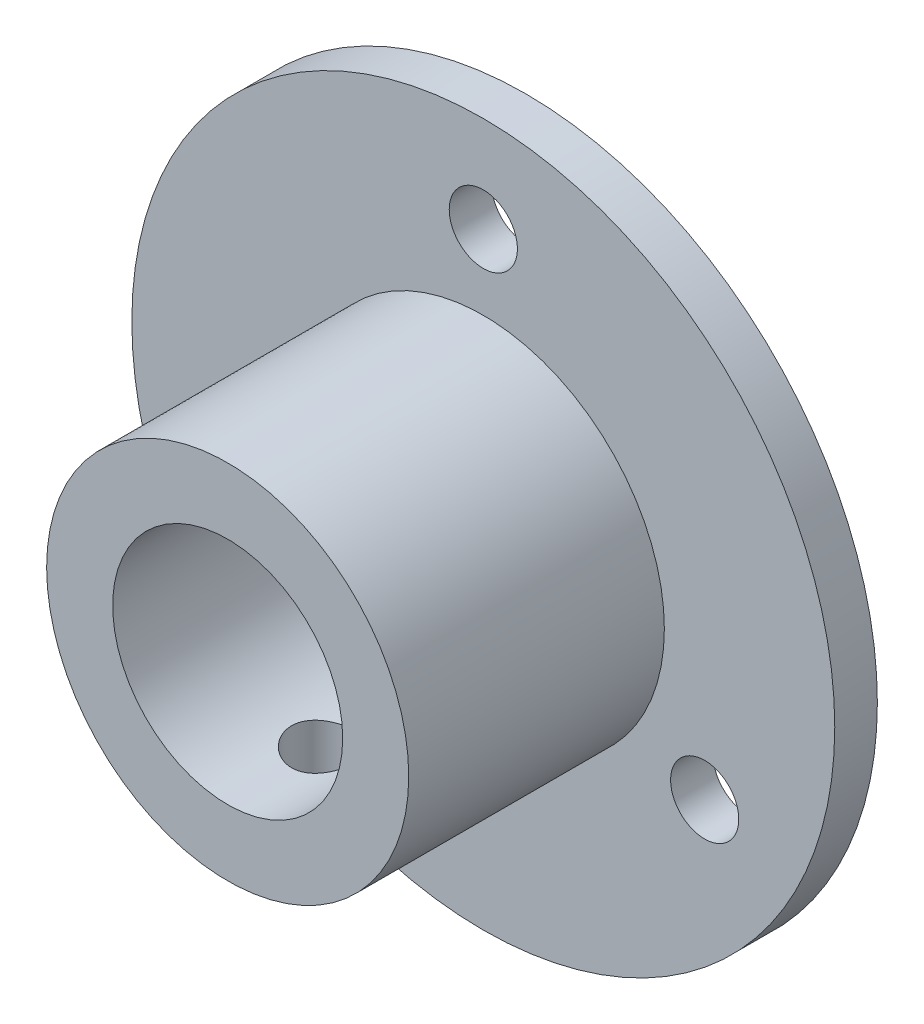
from build123d import *

# Parameters (mm, degrees)
SKETCH_1_R          = 16.5
EXTRUDE_1_DEPTH     = 2
SKETCH_2_R          = 8.5
EXTRUDE_2_DEPTH     = 12
SKETCH_3_R          = 5.4
CUT_EXTRUDE_1_DEPTH = 29
SKETCH_4_R          = 1.6
CUT_EXTRUDE_2_DEPTH = 29
CUT_EXTRUDE_3_DEPTH = 12


with BuildPart() as part:
    # 草图1 → 凸台-拉伸1 (new body)
    with BuildSketch(Plane.XY):
        Circle(SKETCH_1_R)
    extrude(amount=EXTRUDE_1_DEPTH)

    # 草图2 → 凸台-拉伸2 (add)
    with BuildSketch(Plane.XY.offset(2)):
        Circle(SKETCH_2_R)
    extrude(amount=EXTRUDE_2_DEPTH)

    # 草图3 → 切除-拉伸1 (cut)
    with BuildSketch(Plane.XY.offset(14)):
        Circle(SKETCH_3_R)
    extrude(amount=-CUT_EXTRUDE_1_DEPTH, mode=Mode.SUBTRACT)

    # 草图4 → 切除-拉伸2 (cut)
    with BuildSketch(Plane(origin=(0, 0, 0), x_dir=(-1, 0, 0), z_dir=(0, 0, -1))):
        with Locations((0, 12)):
            Circle(SKETCH_4_R)
        with Locations((10.392304845, -6)):
            Circle(SKETCH_4_R)
        with Locations((-10.392304845, -6)):
            Circle(SKETCH_4_R)
    extrude(amount=-CUT_EXTRUDE_2_DEPTH, mode=Mode.SUBTRACT)

    # 草图7 → 切除-拉伸3 (cut)
    with BuildSketch(Plane(origin=(0, 0, 0), x_dir=(1, 0, 0), z_dir=(0, 1, 0))):
        with BuildLine():
            ThreePointArc((0, -11), (1.060660172, -10.560660172), (1.5, -9.5))
            ThreePointArc((1.5, -9.5), (-1.060660172, -8.439339828), (0, -11))
        make_face()
    extrude(amount=-CUT_EXTRUDE_3_DEPTH, mode=Mode.SUBTRACT)


solid = part.part
